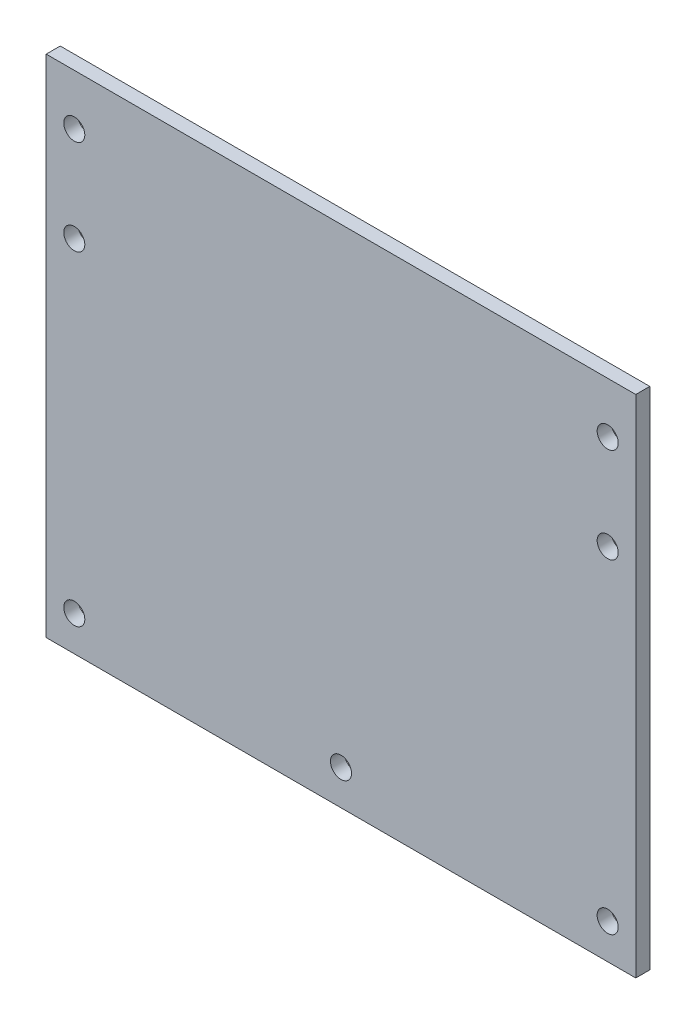
from build123d import *

# Parameters (mm, degrees)
SKETCH1_W           = 533.4
SKETCH1_H           = 457.2
BOSS_EXTRUDE1_DEPTH = 12.7
SKETCH4_R           = 9.525
CUT_EXTRUDE1_DEPTH  = 12.7


with BuildPart() as part:
    # Sketch1 → Boss-Extrude1 (new body)
    with BuildSketch(Plane.XY):
        with Locations((266.7, -228.6)):
            Rectangle(SKETCH1_W, SKETCH1_H)
    extrude(amount=BOSS_EXTRUDE1_DEPTH)

    # Sketch4 → Cut-Extrude1 (cut)
    with BuildSketch(Plane(origin=(0, 0, 0), x_dir=(-1, 0, 0), z_dir=(0, 0, -1))):
        with Locations((-508, -45.974)):
            Circle(SKETCH4_R)
        with Locations((-508, -131.826)):
            Circle(SKETCH4_R)
        with Locations((-508, -425.45)):
            Circle(SKETCH4_R)
        with Locations((-25.4, -425.45)):
            Circle(SKETCH4_R)
        with Locations((-25.4, -131.826)):
            Circle(SKETCH4_R)
        with Locations((-25.4, -45.974)):
            Circle(SKETCH4_R)
        with Locations((-266.7, -425.45)):
            Circle(SKETCH4_R)
    extrude(amount=-CUT_EXTRUDE1_DEPTH, mode=Mode.SUBTRACT)


solid = part.part
